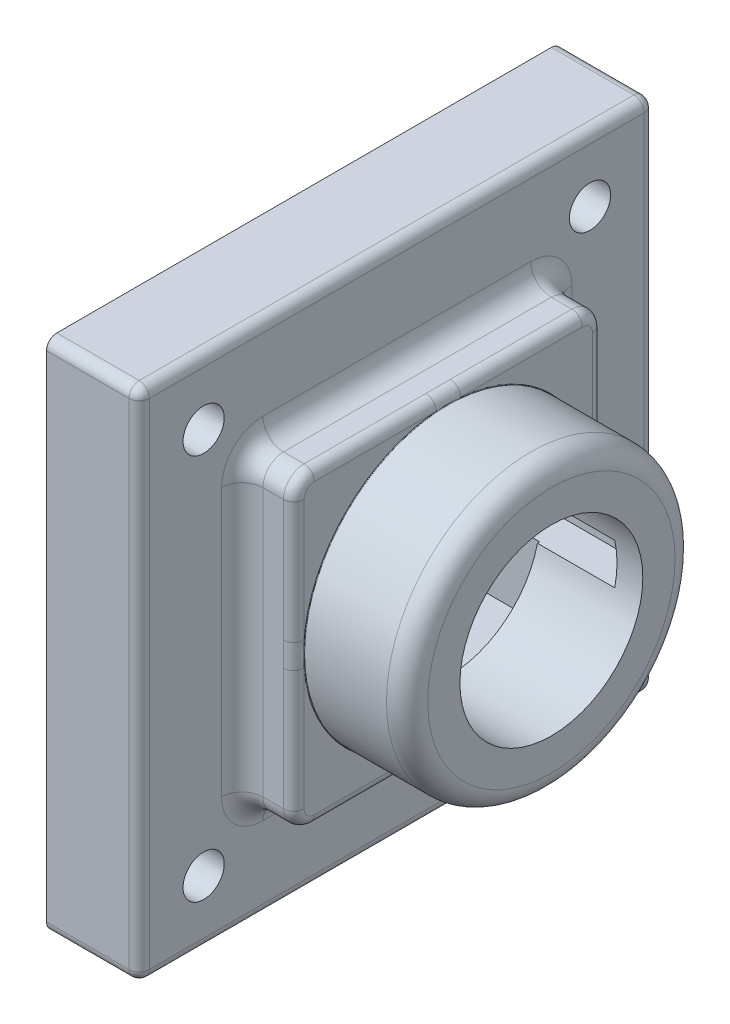
from build123d import *

# Parameters (mm, degrees)
SKETCH1_R           = 14
SKETCH1_R_2         = 8.875
BOSS_EXTRUDE1_DEPTH = 10
SKETCH2_W           = 30
SKETCH2_H           = 30
SKETCH2_W_2         = 17.75
SKETCH2_H_2         = 17.75
BOSS_EXTRUDE2_DEPTH = 8.5
SKETCH3_W           = 50.000000076
SKETCH3_H           = 50
SKETCH3_W_2         = 17.75
SKETCH3_H_2         = 17.75
BOSS_EXTRUDE3_DEPTH = 3.5
SKETCH4_W           = 50.000000076
SKETCH4_H           = 50
SKETCH4_W_2         = 33
SKETCH4_H_2         = 33
BOSS_EXTRUDE4_DEPTH = 5.5
SKETCH5_R           = 2
CUT_EXTRUDE1_DEPTH  = 13.668
FILLET1_R           = 2
SKETCH6_W           = 5
SKETCH6_H           = 24
CUT_EXTRUDE2_DEPTH  = 6
FILLET4_R           = 1
FILLET5_R           = 2
SKETCH7_W           = 24
SKETCH7_H           = 4
CUT_EXTRUDE3_DEPTH  = 16
FILLET6_R           = 0.05
FILLET7_R           = 1


with BuildPart() as part:
    # Sketch1 → Boss-Extrude1 (new body)
    with BuildSketch(Plane(origin=(0, 0, 0), x_dir=(0, 0, -1), z_dir=(1, 0, 0))):
        Circle(SKETCH1_R)
        Circle(SKETCH1_R_2, mode=Mode.SUBTRACT)
    extrude(amount=BOSS_EXTRUDE1_DEPTH)

    # Sketch2 → Boss-Extrude2 (add)
    with BuildSketch(Plane.ZY):
        Rectangle(SKETCH2_W, SKETCH2_H)
        Rectangle(SKETCH2_W_2, SKETCH2_H_2, mode=Mode.SUBTRACT)
    extrude(amount=BOSS_EXTRUDE2_DEPTH)

    # Sketch3 → Boss-Extrude3 (add)
    with BuildSketch(Plane.ZY.offset(8.5)):
        Rectangle(SKETCH3_W, SKETCH3_H)
        Rectangle(SKETCH3_W_2, SKETCH3_H_2, mode=Mode.SUBTRACT)
    extrude(amount=-BOSS_EXTRUDE3_DEPTH)

    # Sketch4 → Boss-Extrude4 (add)
    with BuildSketch(Plane.ZY.offset(8.5)):
        Rectangle(SKETCH4_W, SKETCH4_H)
        Rectangle(SKETCH4_W_2, SKETCH4_H_2, mode=Mode.SUBTRACT)
    extrude(amount=BOSS_EXTRUDE4_DEPTH)

    # Sketch5 → Cut-Extrude1 (cut)
    with BuildSketch(Plane(origin=(-5, 0, 0), x_dir=(0, 0, -1), z_dir=(1, 0, 0))):
        with Locations((-18.750000038, -18.75)):
            Circle(SKETCH5_R)
        with Locations((-18.750000038, 18.75)):
            Circle(SKETCH5_R)
        with Locations((18.750000038, -18.75)):
            Circle(SKETCH5_R)
        with Locations((18.750000038, 18.75)):
            Circle(SKETCH5_R)
    extrude(amount=-CUT_EXTRUDE1_DEPTH, mode=Mode.SUBTRACT)

    # Fillet1
    fillet1_edges = [part.edges().sort_by_distance(p)[0] for p in [
        (-2.5, 15, -15),
        (-2.5, 15, 15),
        (-2.5, -15, 15),
        (-2.5, -15, -15),
        (-5, 0, -15),
        (-5, 15, 0),
        (-5, 0, 15),
        (-5, -15, 0),
    ]]
    fillet(fillet1_edges, radius=FILLET1_R)

    # Sketch6 → Cut-Extrude2 (cut)
    with BuildSketch(Plane.ZY.offset(8.5)):
        Rectangle(SKETCH6_W, SKETCH6_H)
    extrude(amount=-CUT_EXTRUDE2_DEPTH, mode=Mode.SUBTRACT)

    # Fillet4
    fillet4_edges = [part.edges().sort_by_distance(p)[0] for p in [
        (-9.5, -25, -25.000000038),
        (-9.5, 25, -25.000000038),
        (-9.5, 25, 25.000000038),
        (-9.5, -25, 25.000000038),
        (-5, -25, 0),
        (-5, 0, -25.000000038),
        (-5, 25, 0),
        (-5, 0, 25.000000038),
    ]]
    fillet(fillet4_edges, radius=FILLET4_R)

    # Fillet5
    fillet5_edges = [part.edges().sort_by_distance(p)[0] for p in [
        (10, 0, 14),
    ]]
    fillet(fillet5_edges, radius=FILLET5_R)

    # Sketch7 → Cut-Extrude3 (cut)
    with BuildSketch(Plane.ZY.offset(8.5)):
        Rectangle(SKETCH7_W, SKETCH7_H)
    extrude(amount=-CUT_EXTRUDE3_DEPTH, mode=Mode.SUBTRACT)

    # Fillet6
    fillet6_edges = [part.edges().sort_by_distance(p)[0] for p in [
        (0, 0, 14),
    ]]
    fillet(fillet6_edges, radius=FILLET6_R)

    # Fillet7
    fillet7_edges = [part.edges().sort_by_distance(p)[0] for p in [
        (0, -14.414213562, 14.414213562),
        (0, -15, 0),
        (0, -14.414213562, -14.414213562),
        (0, 0, -15),
        (0, 14.414213562, -14.414213562),
        (0, 15, 0),
        (0, 14.414213562, 14.414213562),
        (0, 0, 15),
    ]]
    fillet(fillet7_edges, radius=FILLET7_R)


solid = part.part
